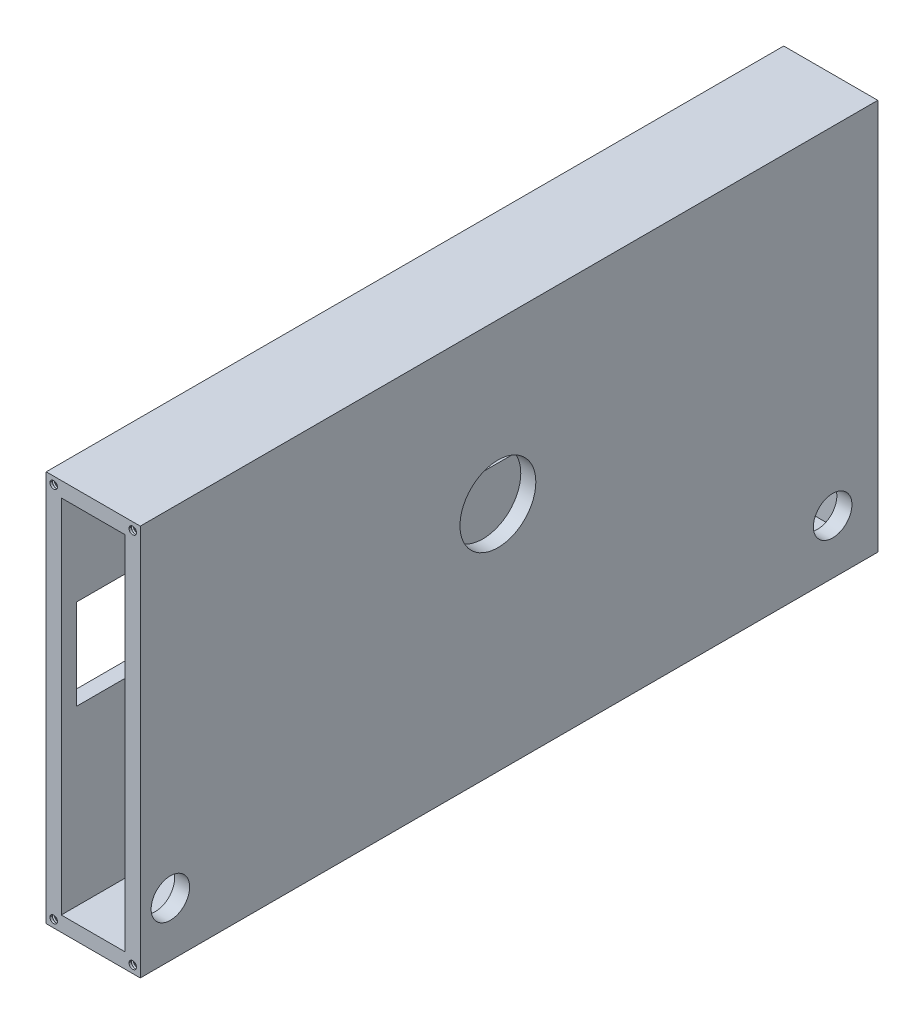
from build123d import *
from build123d.topology import SkipClean

# Parameters (mm, degrees)
SKETCH1_W           = 39.6875
SKETCH1_H           = 165.1
BOSS_EXTRUDE1_DEPTH = 311.15
SHELL1_T            = -6.35
SKETCH2_R           = 8.128
CUT_EXTRUDE2_DEPTH  = 12.7
SKETCH5_R           = 1.5875
CUT_EXTRUDE6_DEPTH  = 6.35
THREAD1_PITCH       = 1.058333333
THREAD2_PITCH       = 1.058333333
THREAD3_PITCH       = 1.058333333
THREAD4_PITCH       = 1.058333333
SKETCH14_W          = 298.45
SKETCH14_H          = 38.1
CUT_EXTRUDE7_DEPTH  = 6.35
SKETCH15_R          = 16.002
CUT_EXTRUDE8_DEPTH  = 12.7


with BuildPart() as part:
    # Sketch1 → Boss-Extrude1 (new body)
    with BuildSketch(Plane.XY):
        with Locations((19.84375, 82.55)):
            Rectangle(SKETCH1_W, SKETCH1_H)
    extrude(amount=-BOSS_EXTRUDE1_DEPTH)

    # Shell1
    shell1_openings = [part.faces().sort_by_distance(p)[0] for p in [
        (19.84375, 82.55, 0),
    ]]
    offset(amount=SHELL1_T, openings=shell1_openings, kind=Kind.INTERSECTION)

    # Sketch2 → Cut-Extrude2 (cut)
    with BuildSketch(Plane(origin=(39.6875, 0, 0), x_dir=(0, 0, -1), z_dir=(1, 0, 0))):
        with Locations((12.7, 22.86)):
            Circle(SKETCH2_R)
        with Locations((292.1, 22.86)):
            Circle(SKETCH2_R)
    extrude(amount=-CUT_EXTRUDE2_DEPTH, mode=Mode.SUBTRACT)

    # Sketch5 → Cut-Extrude6 (cut)
    with BuildSketch(Plane.XY):
        with Locations((3.175, 161.925)):
            Circle(SKETCH5_R)
        with Locations((36.5125, 161.925)):
            Circle(SKETCH5_R)
        with Locations((3.175, 3.175)):
            Circle(SKETCH5_R)
        with Locations((36.5125, 3.175)):
            Circle(SKETCH5_R)
    extrude(amount=-CUT_EXTRUDE6_DEPTH, mode=Mode.SUBTRACT)

    # Thread1: the profile of Thread Profile1 profile screwed along a right-hand helix of 6 turns, 8 arcs to a turn; built about Z, then put on its axis
    with SkipClean():  # the faces are left unmerged after this step: merging them gives an invalid solid
        thread1_z = Axis((0, 0, 0), (0, 0, 1))
        thread1_corners = [(1.5872, 0, -0.000173205), (2.160339718, 0, 0.330729165), (2.160339718, 0, 0.463020832), (1.5872, 0, 0.793923202)]
        with BuildLine(mode=Mode.PRIVATE) as thread1_profile:
            Line(thread1_corners[0], thread1_corners[1])
            Line(thread1_corners[1], thread1_corners[2])
            Line(thread1_corners[2], thread1_corners[3])
            Line(thread1_corners[3], thread1_corners[0])
        thread1_cap = Face(thread1_profile.wire())
        thread1_turn_angles = [0, 22.5, 45, 67.5, 90, 112.5, 135, 157.5, 180, 202.5, 225, 247.5, 270, 292.5, 315, 337.5, 360]
        thread1_turn_weights = [1, 0.9238795325112867, 1, 0.9238795325112867, 1, 0.9238795325112867, 1, 0.9238795325112867, 1, 0.9238795325112867, 1, 0.9238795325112867, 1, 0.9238795325112867, 1, 0.9238795325112867, 1]
        thread1_turn_rails = [Edge.make_bspline([Vector(p[0], p[1], 0).rotate(thread1_z, thread1_turn_angles[k]) / thread1_turn_weights[k] + Vector(0, 0, p[2] + THREAD1_PITCH * thread1_turn_angles[k] / 360) for k in range(17)], [0, 0, 0, 1, 1, 2, 2, 3, 3, 4, 4, 5, 5, 6, 6, 7, 7, 8, 8, 8], 2, thread1_turn_weights) for p in thread1_corners]
        thread1_turn_sides = [Face.make_surface_from_curves(thread1_turn_rails[p[0]], thread1_turn_rails[p[1]]) for p in [(0, 1), (1, 2), (2, 3), (3, 0)]]
        thread1 = Plane(origin=(3.175, 161.925, 0), x_dir=(-1, 0, 0), z_dir=(0, 0, -1)) * Solid(Shell([*[p.moved(Location((0, 0, THREAD1_PITCH * i))) for i in range(6) for p in thread1_turn_sides], thread1_cap, thread1_cap.rotate(thread1_z, 2160).moved(Location((0, 0, THREAD1_PITCH * 2160 / 360)))]))
        add(thread1, mode=Mode.SUBTRACT)

    # Thread2: the profile of Thread Profile2 profile screwed along a right-hand helix of 6 turns, 8 arcs to a turn; built about Z, then put on its axis
    with SkipClean():  # the faces are left unmerged after this step: merging them gives an invalid solid
        thread2_z = Axis((0, 0, 0), (0, 0, 1))
        thread2_corners = [(1.5872, 0, -0.000173205), (2.160339718, 0, 0.330729165), (2.160339718, 0, 0.463020832), (1.5872, 0, 0.793923202)]
        with BuildLine(mode=Mode.PRIVATE) as thread2_profile:
            Line(thread2_corners[0], thread2_corners[1])
            Line(thread2_corners[1], thread2_corners[2])
            Line(thread2_corners[2], thread2_corners[3])
            Line(thread2_corners[3], thread2_corners[0])
        thread2_cap = Face(thread2_profile.wire())
        thread2_turn_angles = [0, 22.5, 45, 67.5, 90, 112.5, 135, 157.5, 180, 202.5, 225, 247.5, 270, 292.5, 315, 337.5, 360]
        thread2_turn_weights = [1, 0.9238795325112867, 1, 0.9238795325112867, 1, 0.9238795325112867, 1, 0.9238795325112867, 1, 0.9238795325112867, 1, 0.9238795325112867, 1, 0.9238795325112867, 1, 0.9238795325112867, 1]
        thread2_turn_rails = [Edge.make_bspline([Vector(p[0], p[1], 0).rotate(thread2_z, thread2_turn_angles[k]) / thread2_turn_weights[k] + Vector(0, 0, p[2] + THREAD2_PITCH * thread2_turn_angles[k] / 360) for k in range(17)], [0, 0, 0, 1, 1, 2, 2, 3, 3, 4, 4, 5, 5, 6, 6, 7, 7, 8, 8, 8], 2, thread2_turn_weights) for p in thread2_corners]
        thread2_turn_sides = [Face.make_surface_from_curves(thread2_turn_rails[p[0]], thread2_turn_rails[p[1]]) for p in [(0, 1), (1, 2), (2, 3), (3, 0)]]
        thread2 = Plane(origin=(36.5125, 161.925, 0), x_dir=(-1, 0, 0), z_dir=(0, 0, -1)) * Solid(Shell([*[p.moved(Location((0, 0, THREAD2_PITCH * i))) for i in range(6) for p in thread2_turn_sides], thread2_cap, thread2_cap.rotate(thread2_z, 2160).moved(Location((0, 0, THREAD2_PITCH * 2160 / 360)))]))
        add(thread2, mode=Mode.SUBTRACT)

    # Thread3: the profile of Thread Profile3 profile screwed along a right-hand helix of 6 turns, 8 arcs to a turn; built about Z, then put on its axis
    with SkipClean():  # the faces are left unmerged after this step: merging them gives an invalid solid
        thread3_z = Axis((0, 0, 0), (0, 0, 1))
        thread3_corners = [(1.5872, 0, -0.000173205), (2.160339718, 0, 0.330729165), (2.160339718, 0, 0.463020832), (1.5872, 0, 0.793923202)]
        with BuildLine(mode=Mode.PRIVATE) as thread3_profile:
            Line(thread3_corners[0], thread3_corners[1])
            Line(thread3_corners[1], thread3_corners[2])
            Line(thread3_corners[2], thread3_corners[3])
            Line(thread3_corners[3], thread3_corners[0])
        thread3_cap = Face(thread3_profile.wire())
        thread3_turn_angles = [0, 22.5, 45, 67.5, 90, 112.5, 135, 157.5, 180, 202.5, 225, 247.5, 270, 292.5, 315, 337.5, 360]
        thread3_turn_weights = [1, 0.9238795325112867, 1, 0.9238795325112867, 1, 0.9238795325112867, 1, 0.9238795325112867, 1, 0.9238795325112867, 1, 0.9238795325112867, 1, 0.9238795325112867, 1, 0.9238795325112867, 1]
        thread3_turn_rails = [Edge.make_bspline([Vector(p[0], p[1], 0).rotate(thread3_z, thread3_turn_angles[k]) / thread3_turn_weights[k] + Vector(0, 0, p[2] + THREAD3_PITCH * thread3_turn_angles[k] / 360) for k in range(17)], [0, 0, 0, 1, 1, 2, 2, 3, 3, 4, 4, 5, 5, 6, 6, 7, 7, 8, 8, 8], 2, thread3_turn_weights) for p in thread3_corners]
        thread3_turn_sides = [Face.make_surface_from_curves(thread3_turn_rails[p[0]], thread3_turn_rails[p[1]]) for p in [(0, 1), (1, 2), (2, 3), (3, 0)]]
        thread3 = Plane(origin=(3.175, 3.175, 0), x_dir=(-1, 0, 0), z_dir=(0, 0, -1)) * Solid(Shell([*[p.moved(Location((0, 0, THREAD3_PITCH * i))) for i in range(6) for p in thread3_turn_sides], thread3_cap, thread3_cap.rotate(thread3_z, 2160).moved(Location((0, 0, THREAD3_PITCH * 2160 / 360)))]))
        add(thread3, mode=Mode.SUBTRACT)

    # Thread4: the profile of Thread Profile4 profile screwed along a right-hand helix of 6 turns, 8 arcs to a turn; built about Z, then put on its axis
    with SkipClean():  # the faces are left unmerged after this step: merging them gives an invalid solid
        thread4_z = Axis((0, 0, 0), (0, 0, 1))
        thread4_corners = [(1.5872, 0, -0.000173205), (2.160339718, 0, 0.330729165), (2.160339718, 0, 0.463020832), (1.5872, 0, 0.793923202)]
        with BuildLine(mode=Mode.PRIVATE) as thread4_profile:
            Line(thread4_corners[0], thread4_corners[1])
            Line(thread4_corners[1], thread4_corners[2])
            Line(thread4_corners[2], thread4_corners[3])
            Line(thread4_corners[3], thread4_corners[0])
        thread4_cap = Face(thread4_profile.wire())
        thread4_turn_angles = [0, 22.5, 45, 67.5, 90, 112.5, 135, 157.5, 180, 202.5, 225, 247.5, 270, 292.5, 315, 337.5, 360]
        thread4_turn_weights = [1, 0.9238795325112867, 1, 0.9238795325112867, 1, 0.9238795325112867, 1, 0.9238795325112867, 1, 0.9238795325112867, 1, 0.9238795325112867, 1, 0.9238795325112867, 1, 0.9238795325112867, 1]
        thread4_turn_rails = [Edge.make_bspline([Vector(p[0], p[1], 0).rotate(thread4_z, thread4_turn_angles[k]) / thread4_turn_weights[k] + Vector(0, 0, p[2] + THREAD4_PITCH * thread4_turn_angles[k] / 360) for k in range(17)], [0, 0, 0, 1, 1, 2, 2, 3, 3, 4, 4, 5, 5, 6, 6, 7, 7, 8, 8, 8], 2, thread4_turn_weights) for p in thread4_corners]
        thread4_turn_sides = [Face.make_surface_from_curves(thread4_turn_rails[p[0]], thread4_turn_rails[p[1]]) for p in [(0, 1), (1, 2), (2, 3), (3, 0)]]
        thread4 = Plane(origin=(36.5125, 3.175, 0), x_dir=(-1, 0, 0), z_dir=(0, 0, -1)) * Solid(Shell([*[p.moved(Location((0, 0, THREAD4_PITCH * i))) for i in range(6) for p in thread4_turn_sides], thread4_cap, thread4_cap.rotate(thread4_z, 2160).moved(Location((0, 0, THREAD4_PITCH * 2160 / 360)))]))
        add(thread4, mode=Mode.SUBTRACT)

    # Sketch14 → Cut-Extrude7 (cut)
    with SkipClean():  # the faces are left unmerged after this step: merging them gives an invalid solid
        with BuildSketch(Plane.ZY):
            with Locations((-155.575, 98.425)):
                Rectangle(SKETCH14_W, SKETCH14_H)
        extrude(amount=-CUT_EXTRUDE7_DEPTH, mode=Mode.SUBTRACT)

    # Sketch15 → Cut-Extrude8 (cut)
    with SkipClean():  # the faces are left unmerged after this step: merging them gives an invalid solid
        with BuildSketch(Plane(origin=(39.6875, 0, 0), x_dir=(0, 0, -1), z_dir=(1, 0, 0))):
            with Locations((150.876, 97.79)):
                Circle(SKETCH15_R)
        extrude(amount=-CUT_EXTRUDE8_DEPTH, mode=Mode.SUBTRACT)


solid = part.part
